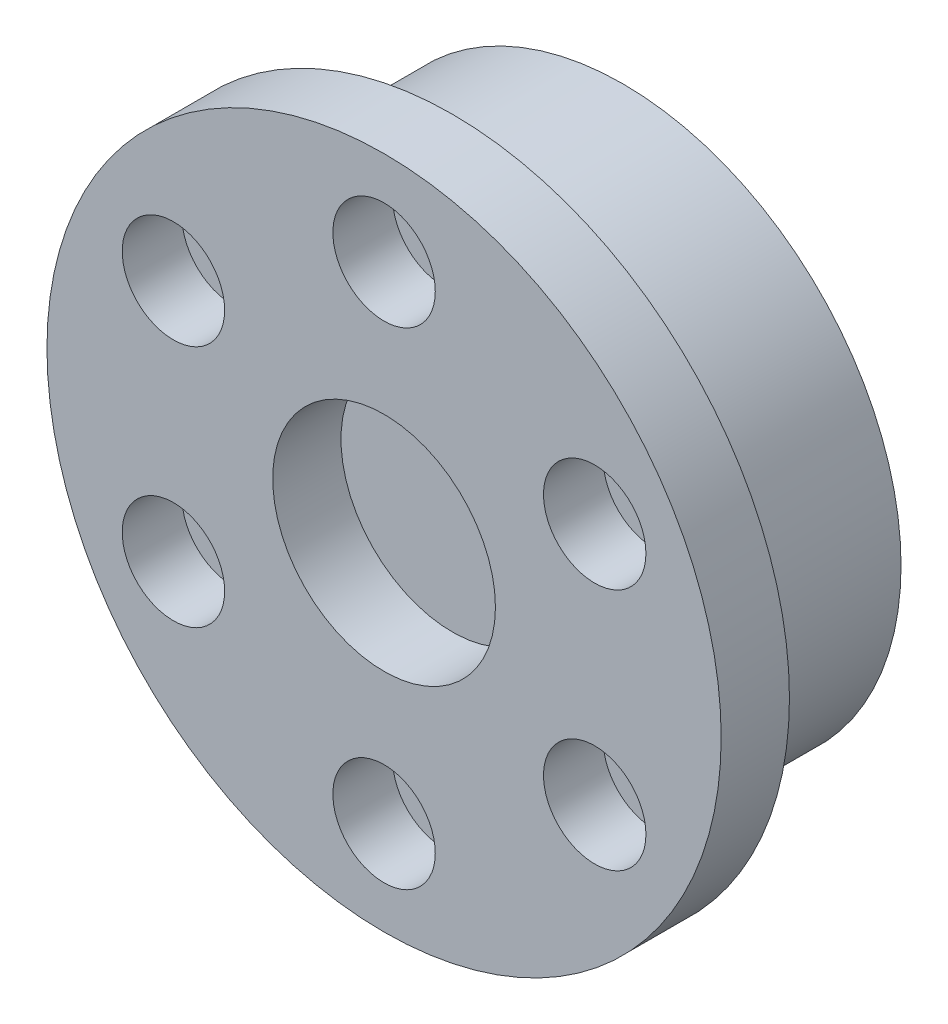
from build123d import *

# Parameters (mm, degrees)
SKETCH1_R           = 39.5
SKETCH1_R_2         = 13.05
BOSS_EXTRUDE1_DEPTH = 8
SKETCH2_R           = 32.575
SKETCH2_R_2         = 2.55
BOSS_EXTRUDE3_DEPTH = 20
SKETCH1_5_R         = 6
CUT_EXTRUDE1_DEPTH  = 7


with BuildPart() as part:
    # Sketch1 → Boss-Extrude1 (new body)
    with BuildSketch(Plane.XY):
        Circle(SKETCH1_R)
        Circle(SKETCH1_R_2, mode=Mode.SUBTRACT)
    extrude(amount=-BOSS_EXTRUDE1_DEPTH)

    # Sketch2 → Boss-Extrude3 (add)
    with BuildSketch(Plane(origin=(0, 0, -8), x_dir=(-1, 0, 0), z_dir=(0, 0, -1))):
        Circle(SKETCH2_R)
        with Locations((0, 25)):
            Circle(SKETCH2_R_2, mode=Mode.SUBTRACT)
        with Locations((21.650635095, 12.5)):
            Circle(SKETCH2_R_2, mode=Mode.SUBTRACT)
        with Locations((21.650635095, -12.5)):
            Circle(SKETCH2_R_2, mode=Mode.SUBTRACT)
        with Locations((0, -25)):
            Circle(SKETCH2_R_2, mode=Mode.SUBTRACT)
        with Locations((-21.650635095, -12.5)):
            Circle(SKETCH2_R_2, mode=Mode.SUBTRACT)
        with Locations((-21.650635095, 12.5)):
            Circle(SKETCH2_R_2, mode=Mode.SUBTRACT)
    extrude(amount=BOSS_EXTRUDE3_DEPTH)

    # Sketch1<5> → Cut-Extrude1 (cut)
    with BuildSketch(Plane.XY):
        with Locations((0, 28.5)):
            Circle(SKETCH1_5_R)
        with Locations((24.681724008, 14.25)):
            Circle(SKETCH1_5_R)
        with Locations((24.681724008, -14.25)):
            Circle(SKETCH1_5_R)
        with Locations((0, -28.5)):
            Circle(SKETCH1_5_R)
        with Locations((-24.681724008, -14.25)):
            Circle(SKETCH1_5_R)
        with Locations((-24.681724008, 14.25)):
            Circle(SKETCH1_5_R)
    extrude(amount=-CUT_EXTRUDE1_DEPTH, mode=Mode.SUBTRACT)


solid = part.part
